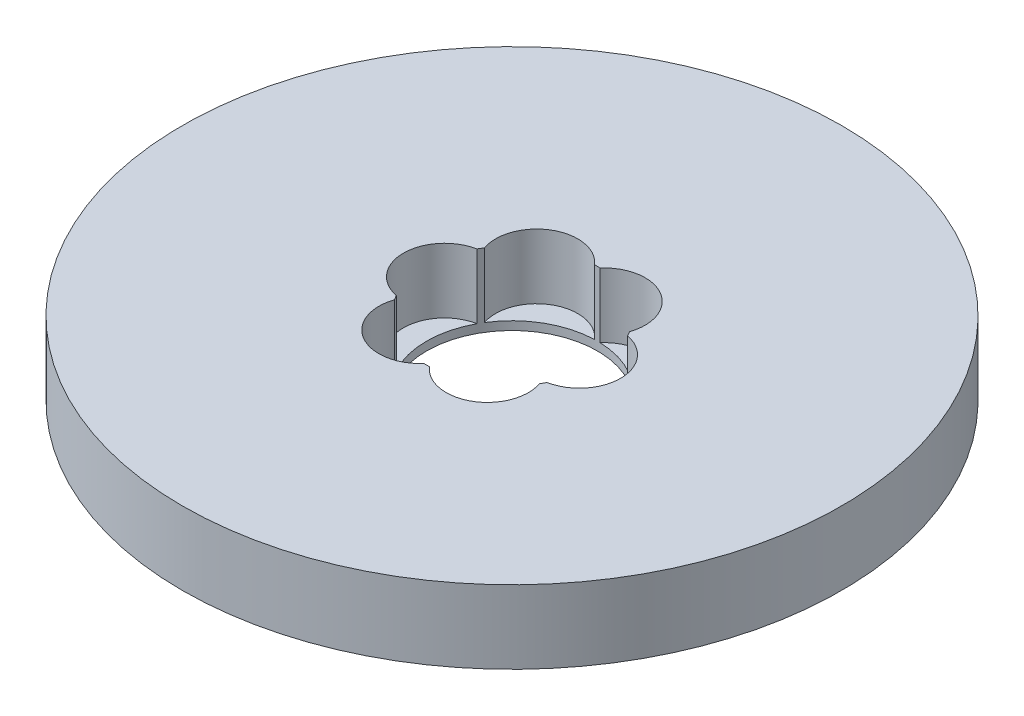
from build123d import *

# Parameters (mm, degrees)
SKETCH1_R           = 67.5
BOSS_EXTRUDE1_DEPTH = 15
SKETCH2_R           = 17.5
CUT_EXTRUDE1_DEPTH  = 97.63074045
SKETCH3_R           = 8.420856642
CUT_EXTRUDE2_DEPTH  = 13.255114727
CIRPATTERN1_COUNT   = 6


with BuildPart() as part:
    # Sketch1 → Boss-Extrude1 (new body)
    with BuildSketch(Plane(origin=(0, 0, 0), x_dir=(1, 0, 0), z_dir=(0, 1, 0))):
        Circle(SKETCH1_R)
    extrude(amount=BOSS_EXTRUDE1_DEPTH)

    # Sketch2 → Cut-Extrude1 (cut, through all)
    with BuildSketch(Plane(origin=(0, 0, 0), x_dir=(1, 0, 0), z_dir=(0, 1, 0))):
        Circle(SKETCH2_R)
    extrude(amount=CUT_EXTRUDE1_DEPTH, mode=Mode.SUBTRACT)

    # Sketch3 → Cut-Extrude2 (cut)
    with BuildSketch(Plane(origin=(0, 15, 0), x_dir=(1, 0, 0), z_dir=(0, 1, 0))):
        with Locations((-13.807559726, 0)):
            Circle(SKETCH3_R)
    cut_extrude2 = extrude(amount=-CUT_EXTRUDE2_DEPTH, mode=Mode.SUBTRACT)

    # CirPattern1: Cut-Extrude2 ×6 about axis
    cirpattern1_axis = Axis((0, 0, 0), (0, 1, 0))
    for i in range(1, CIRPATTERN1_COUNT):
        add(cut_extrude2.rotate(cirpattern1_axis, i * 360 / CIRPATTERN1_COUNT), mode=Mode.SUBTRACT)


solid = part.part
